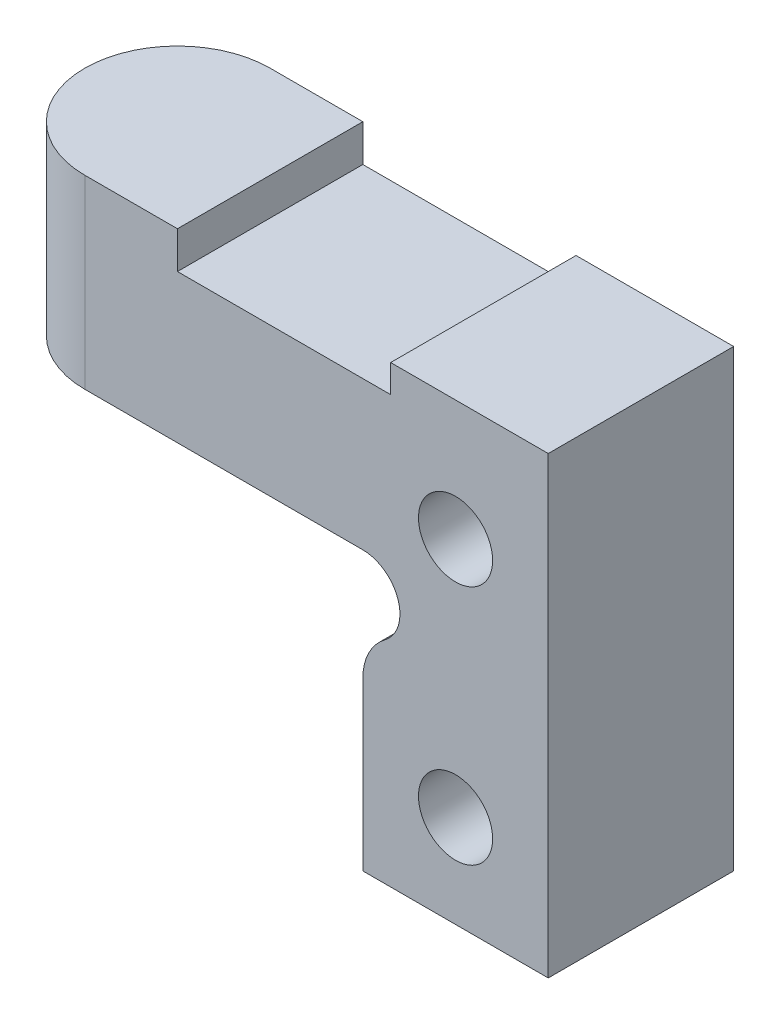
from build123d import *

# Parameters (mm, degrees)
BOSS_EXTRUDE1_DEPTH     = 10
SKETCH2_W               = 11.5
SKETCH2_H               = 17.246462599
CUT_EXTRUDE1_DEPTH      = 2
FILLET1_R               = 5
SKETCH4_R               = 2.15
CUT_EXTRUDE4_DEPTH      = 5
SKETCH6_W               = 10
SKETCH6_H               = 10
BOSS_EXTRUDE2_DEPTH     = 15
SKETCH5_R               = 2
CUT_EXTRUDE5_DEPTH      = 7
SKETCH7_W               = 8.5
SKETCH7_H               = 10
CUT_EXTRUDE6_DEPTH      = 0.5
CUT_EXTRUDE7_DEPTH      = 36
CUT_EXTRUDE7_DEPTH_BACK = 36
SKETCH8_R               = 2
FILLET2_R               = 3


with BuildPart() as part:
    # Sketch1 → Boss-Extrude1 (new body)
    with BuildSketch(Plane(origin=(0, 0, 0), x_dir=(1, 0, 0), z_dir=(0, 1, 0))):
        Polygon((0, 0), (20, 0), (30, 0), (30, 10), (0, 10), align=None)
    extrude(amount=BOSS_EXTRUDE1_DEPTH)

    # Sketch2 → Cut-Extrude1 (cut)
    with BuildSketch(Plane(origin=(0, 10, 0), x_dir=(1, 0, 0), z_dir=(0, 1, 0))):
        with Locations((15.75, 1.3767687)):
            Rectangle(SKETCH2_W, SKETCH2_H)
    extrude(amount=-CUT_EXTRUDE1_DEPTH, mode=Mode.SUBTRACT)

    # Fillet1
    fillet1_edges = [part.edges().sort_by_distance(p)[0] for p in [
        (0, 5, -10),
        (0, 5, 0),
    ]]
    fillet(fillet1_edges, radius=FILLET1_R - 0.0001)  # a hair under: the kernel refuses the full size

    # Sketch4 → Cut-Extrude4 (cut)
    with BuildSketch(Plane.XZ):
        with Locations(Location((6.5, -5, 0), (0, 0, 270))):
            Circle(SKETCH4_R)
    extrude(amount=-CUT_EXTRUDE4_DEPTH, mode=Mode.SUBTRACT)

    # Sketch6 → Boss-Extrude2 (add)
    with BuildSketch(Plane.XZ):
        with Locations((25, -5)):
            Rectangle(SKETCH6_W, SKETCH6_H)
    extrude(amount=BOSS_EXTRUDE2_DEPTH)

    # Sketch5 → Cut-Extrude5 (cut)
    with BuildSketch(Plane.XY):
        with Locations((25, 3)):
            Circle(SKETCH5_R)
        with Locations((25, -10)):
            Circle(SKETCH5_R)
    extrude(amount=-CUT_EXTRUDE5_DEPTH, mode=Mode.SUBTRACT)

    # Sketch7 → Cut-Extrude6 (cut)
    with BuildSketch(Plane(origin=(0, 10, 0), x_dir=(1, 0, 0), z_dir=(0, 1, 0))):
        with Locations((25.75, 5)):
            Rectangle(SKETCH7_W, SKETCH7_H)
    extrude(amount=-CUT_EXTRUDE6_DEPTH, mode=Mode.SUBTRACT)

    # Sketch8 → Cut-Extrude7 (cut, two sides: drawn at the far end of the back side and taken through both)
    with BuildSketch(Plane(origin=(0, 0, -10), x_dir=(-1, 0, 0), z_dir=(0, 0, -1)).offset(-CUT_EXTRUDE7_DEPTH_BACK)):
        with Locations((-20, -2)):
            Circle(SKETCH8_R)
    extrude(amount=CUT_EXTRUDE7_DEPTH + CUT_EXTRUDE7_DEPTH_BACK, mode=Mode.SUBTRACT)

    # Fillet2
    fillet2_edges = [part.edges().sort_by_distance(p)[0] for p in [
        (20, -4, -5),
    ]]
    fillet(fillet2_edges, radius=FILLET2_R)


solid = part.part
